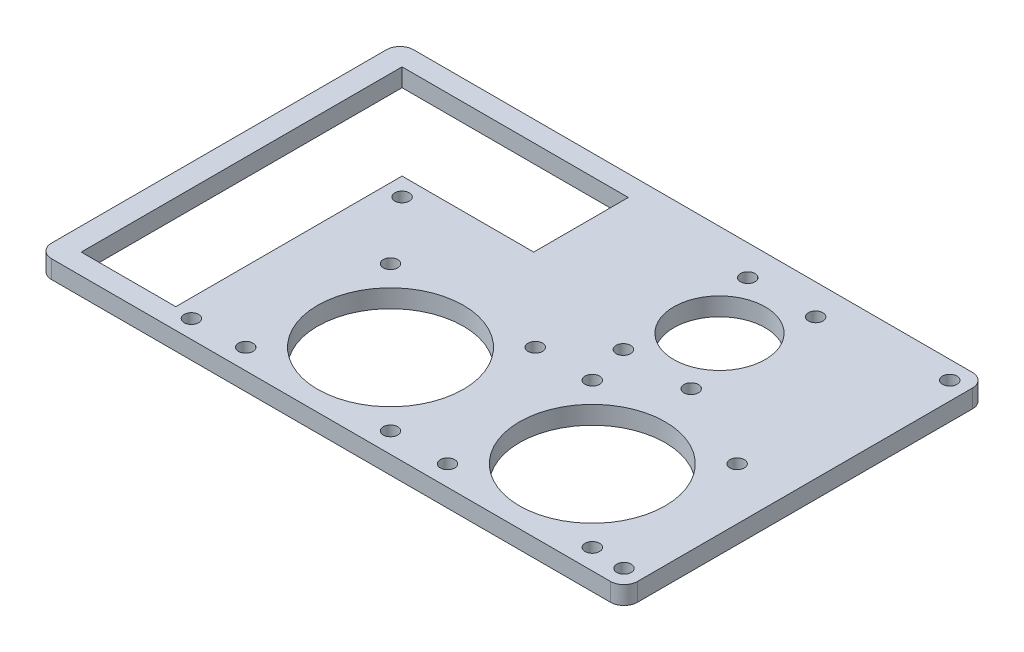
from build123d import *

# Parameters (mm, degrees)
SKETCH1_W           = 129.5
SKETCH1_H           = 80
BOSS_EXTRUDE1_DEPTH = 4
FILLET1_R           = 3
CUT_EXTRUDE1_DEPTH  = 10
SKETCH3_R           = 1.6
SKETCH3_R_2         = 10.1
SKETCH3_R_3         = 16.1
CUT_EXTRUDE2_DEPTH  = 10
SKETCH4_R           = 1.6
CUT_EXTRUDE3_DEPTH  = 10


with BuildPart() as part:
    # Sketch1 → Boss-Extrude1 (new body)
    with BuildSketch(Plane(origin=(0, 0, 0), x_dir=(1, 0, 0), z_dir=(0, 1, 0))):
        with Locations((64.75, 40)):
            Rectangle(SKETCH1_W, SKETCH1_H)
    extrude(amount=BOSS_EXTRUDE1_DEPTH)

    # Fillet1
    fillet1_edges = [part.edges().sort_by_distance(p)[0] for p in [
        (0, 2, -80),
        (0, 2, 0),
        (129.5, 2, -80),
        (129.5, 2, 0),
    ]]
    fillet(fillet1_edges, radius=FILLET1_R)

    # Sketch2 → Cut-Extrude1 (cut)
    with BuildSketch(Plane(origin=(0, 4, 0), x_dir=(1, 0, 0), z_dir=(0, 1, 0))):
        Polygon((5, 4.55), (25.9, 4.55), (25.9, 54.55), (55, 54.55), (55, 75.45), (5, 75.45), (5, 40), align=None)
    extrude(amount=-CUT_EXTRUDE1_DEPTH, mode=Mode.SUBTRACT)

    # Sketch3 → Cut-Extrude2 (cut)
    with BuildSketch(Plane(origin=(0, 4, 0), x_dir=(1, 0, 0), z_dir=(0, 1, 0))):
        with Locations((98.55, 73.3)):
            Circle(SKETCH3_R)
        with Locations((83.55, 73.3)):
            Circle(SKETCH3_R)
        with Locations((98.55, 45.8)):
            Circle(SKETCH3_R)
        with Locations((83.55, 45.8)):
            Circle(SKETCH3_R)
        with Locations((91.05, 59.55)):
            Circle(SKETCH3_R_2)
        with Locations((73.4, 36.5)):
            Circle(SKETCH3_R)
        with Locations((41.4, 36.5)):
            Circle(SKETCH3_R)
        with Locations((73.4, 4.5)):
            Circle(SKETCH3_R)
        with Locations((41.4, 4.5)):
            Circle(SKETCH3_R)
        with Locations((86, 36.5)):
            Circle(SKETCH3_R)
        with Locations((118, 36.5)):
            Circle(SKETCH3_R)
        with Locations((118, 4.5)):
            Circle(SKETCH3_R)
        with Locations((86, 4.5)):
            Circle(SKETCH3_R)
        with Locations((57.4, 20.5)):
            Circle(SKETCH3_R_3)
        with Locations((102, 20.5)):
            Circle(SKETCH3_R_3)
    extrude(amount=-CUT_EXTRUDE2_DEPTH, mode=Mode.SUBTRACT)

    # Sketch4 → Cut-Extrude3 (cut)
    with BuildSketch(Plane(origin=(0, 4, 0), x_dir=(1, 0, 0), z_dir=(0, 1, 0))):
        with Locations((125.5, 4)):
            Circle(SKETCH4_R)
        with Locations((125.5, 76)):
            Circle(SKETCH4_R)
        with Locations((29.9, 50.55)):
            Circle(SKETCH4_R)
        with Locations((29.9, 4)):
            Circle(SKETCH4_R)
    extrude(amount=-CUT_EXTRUDE3_DEPTH, mode=Mode.SUBTRACT)


solid = part.part
